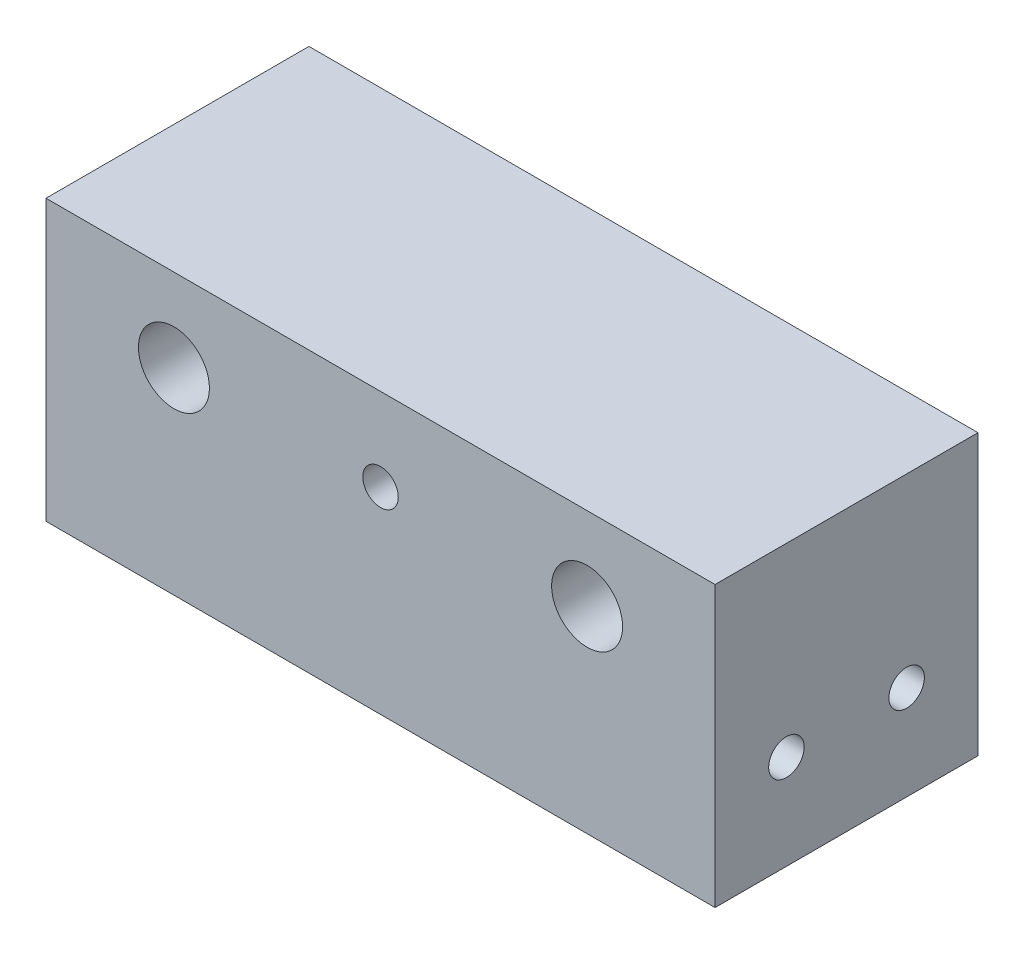
from build123d import *

# Parameters (mm, degrees)
SKETCH1_W           = 56.55
SKETCH1_H           = 22.225
BOSS_EXTRUDE1_DEPTH = 22.225
SKETCH2_R           = 3
SKETCH2_R_2         = 1.5
CUT_EXTRUDE1_DEPTH  = 10
SKETCH3_R           = 1.5
CUT_EXTRUDE2_DEPTH  = 10
SKETCH5_W           = 56.55
SKETCH5_H           = 22.225
BOSS_EXTRUDE2_DEPTH = 1.42494
SKETCH6_R           = 3.025
CUT_EXTRUDE3_DEPTH  = 8


with BuildPart() as part:
    # Sketch1 → Boss-Extrude1 (new body)
    with BuildSketch(Plane.XY):
        Rectangle(SKETCH1_W, SKETCH1_H)
    extrude(amount=BOSS_EXTRUDE1_DEPTH)

    # Sketch2 → Cut-Extrude1 (cut)
    with BuildSketch(Plane.XY.offset(22.225)):
        with Locations((17.4625, 4.1125)):
            Circle(SKETCH2_R)
        with Locations((-17.4625, 4.1125)):
            Circle(SKETCH2_R)
        with Locations((0, 4.1125)):
            Circle(SKETCH2_R_2)
    extrude(amount=-CUT_EXTRUDE1_DEPTH, mode=Mode.SUBTRACT)

    # Sketch3 → Cut-Extrude2 (cut)
    with BuildSketch(Plane.ZY.offset(28.275)):
        with Locations((16.1925, -4.5375001)):
            Circle(SKETCH3_R)
        with Locations((6.0325, -4.5375001)):
            Circle(SKETCH3_R)
    cut_extrude2 = extrude(amount=-CUT_EXTRUDE2_DEPTH, mode=Mode.SUBTRACT)

    # Sketch5 → Boss-Extrude2 (add)
    with BuildSketch(Plane.XZ.offset(11.1125)):
        with Locations((0, 11.1125)):
            Rectangle(SKETCH5_W, SKETCH5_H)
    extrude(amount=BOSS_EXTRUDE2_DEPTH)

    # Sketch6 → Cut-Extrude3 (cut)
    with BuildSketch(Plane(origin=(0, 0, 0), x_dir=(-1, 0, 0), z_dir=(0, 0, -1))):
        Circle(SKETCH6_R)
    extrude(amount=-CUT_EXTRUDE3_DEPTH, mode=Mode.SUBTRACT)

    # Mirror2: Cut-Extrude2 across plane
    add(cut_extrude2.mirror(Plane(origin=(0, 0, 0), x_dir=(0, 0, 1), z_dir=(1, 0, 0))), mode=Mode.SUBTRACT)


solid = part.part
